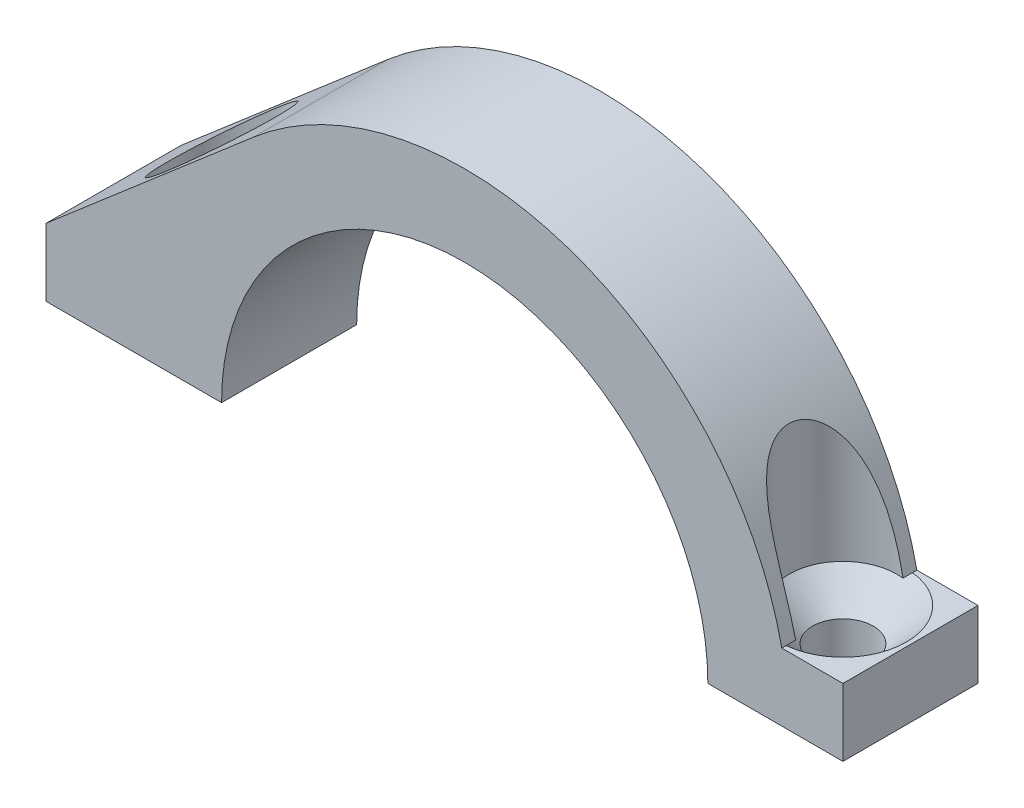
from build123d import *

# Parameters (mm, degrees)
EXTRUDE_1_DEPTH     = 10
CUT_EXTRUDE_1_REACH = 106.47
SKETCH_2_R          = 4


# Read off the part's stored shape, not the designer's step: 高级异型孔1
with BuildPart() as part:
    # 草图1 → 凸台-拉伸1 (new body)
    with BuildSketch(Plane.XY.offset(58)):
        with BuildLine():
            Line((31, 26), (18, 26))
            Line((18, 26), (18, 31))
            Line((18, 31), (33.354781752, 44.199646864))
            ThreePointArc((33.354781752, 44.199646864), (56.673182808, 48.74032246), (72.473389189, 31))
            Line((72.473389189, 31), (77, 31))
            Line((77, 31), (77, 26))
            Line((77, 26), (67, 26))
            ThreePointArc((67, 26), (49, 44), (31, 26))
        make_face()
    extrude(amount=EXTRUDE_1_DEPTH)

    # 草图2 → 切除-拉伸1 (cut, up to next)
    with BuildSketch(Plane(origin=(0, 31, 0), x_dir=(1, 0, 0), z_dir=(0, 1, 0)), mode=Mode.PRIVATE) as cut_extrude_1_sk1:
        with Locations(Location((26, -63, 0), (0, 0, 180))):
            Circle(SKETCH_2_R)
    cut_extrude_1_tool1 = extrude(cut_extrude_1_sk1.sketch, amount=CUT_EXTRUDE_1_REACH, mode=Mode.PRIVATE) & part.part
    # 草图2 → 切除-拉伸1 (cut, up to next)
    with BuildSketch(Plane(origin=(0, 31, 0), x_dir=(1, 0, 0), z_dir=(0, 1, 0)), mode=Mode.PRIVATE) as cut_extrude_1_sk2:
        with Locations((72, -63)):
            Circle(SKETCH_2_R)
    cut_extrude_1_tool2 = extrude(cut_extrude_1_sk2.sketch, amount=CUT_EXTRUDE_1_REACH, mode=Mode.PRIVATE) & part.part
    add(cut_extrude_1_tool1.solids().sort_by_distance((26, 31, 63))[0], mode=Mode.SUBTRACT)
    add(cut_extrude_1_tool2.solids().sort_by_distance((72, 31, 63))[0], mode=Mode.SUBTRACT)

    # 高级异型孔1 outline → 高级异型孔1 (revolve, cut)
    with BuildSketch(Plane(origin=(72, 0, 63), x_dir=(1, 0, 0), z_dir=(0, 0, 1))):
        Polygon((0, 26), (2.25, 26), (2.25, 28.55), (4.7, 31), (0, 31), align=None)
    revolve(axis=Axis((72, 0, 63), (0, 1, 0)), mode=Mode.SUBTRACT)

    # Other 1 2 outline → Other 1 2 (revolve, cut)
    with BuildSketch(Plane(origin=(26, 0, 63), x_dir=(1, 0, 0), z_dir=(0, 0, 1))):
        Polygon((4.7, 31), (0, 31), (0, 26), (2.25, 26), (2.25, 28.55), align=None)
    revolve(axis=Axis((26, 0, 63), (0, 1, 0)), mode=Mode.SUBTRACT)


solid = part.part
